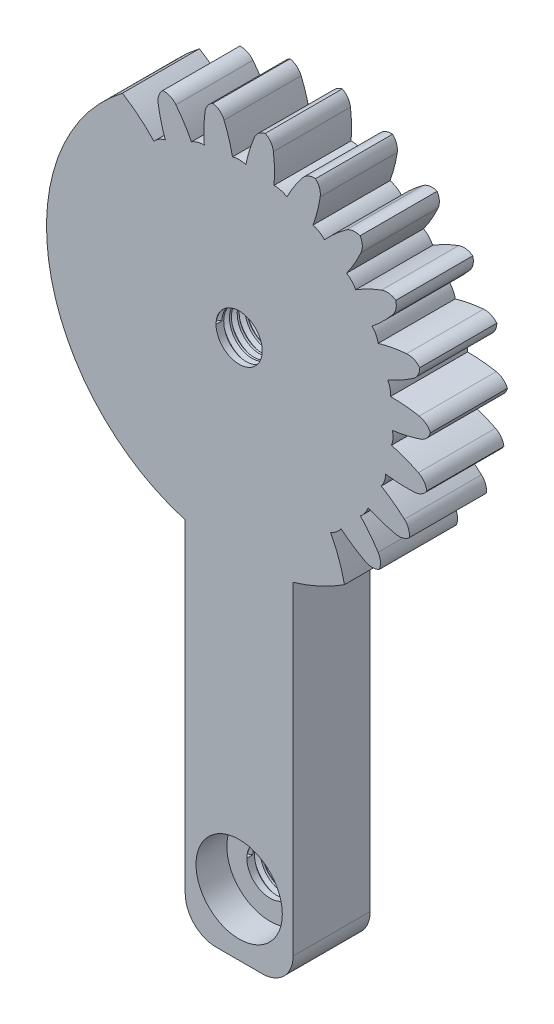
from build123d import *

# Parameters (mm, degrees)
BOSS_EXTRUDE2_DEPTH = 5
SKETCH3_R           = 1.5
CUT_EXTRUDE1_DEPTH  = 38.5
CUT_EXTRUDE2_DEPTH  = 38.5
CIRPATTERN1_COUNT   = 23
FILLET1_R           = 2
SKETCH14_R          = 2.8
CUT_EXTRUDE3_DEPTH  = 2
SKETCH15_R          = 1.5
CUT_EXTRUDE4_DEPTH  = 38.286056375
THREAD1_PITCH       = 0.5
THREAD2_PITCH       = 0.5
FILLET4_R           = 1


with BuildPart() as part:
    # Sketch1 → Boss-Extrude2 (new body)
    with BuildSketch(Plane.XY):
        with BuildLine():
            Line((3.5, -35), (3.5, -12))
            ThreePointArc((3.5, -12), (0, 12.5), (-3.5, -12))
            Line((-3.5, -12), (-3.5, -35))
            Line((-3.5, -35), (3.5, -35))
        make_face()
    extrude(amount=BOSS_EXTRUDE2_DEPTH)

    # Sketch3 → Cut-Extrude1 (cut, through all)
    with BuildSketch(Plane.XY.offset(5)):
        Circle(SKETCH3_R)
    extrude(amount=-CUT_EXTRUDE1_DEPTH, mode=Mode.SUBTRACT)

    # Sketch6 → Cut-Extrude2 (cut, through all)
    with BuildSketch(Plane.XY.offset(5)):
        with BuildLine():
            ThreePointArc((1.306605791, 12.431523692), (0, 12.5), (-1.306605791, 12.431523692))
            ThreePointArc((-1.306605791, 12.431523692), (-0.782967595, 11.214222444), (-0.433810754, 9.935899798))
            ThreePointArc((-0.433810754, 9.935899798), (0, 10), (0.433810754, 9.935899798))
            ThreePointArc((0.433810754, 9.935899798), (0.782967595, 11.214222444), (1.306605791, 12.431523692))
        make_face()
    cut_extrude2 = extrude(amount=-CUT_EXTRUDE2_DEPTH, mode=Mode.SUBTRACT)

    # CirPattern1: Cut-Extrude2 ×23 about axis, 11 skipped
    cirpattern1_axis = Axis((0, 0, 0), (0, 0, -1))
    add([cut_extrude2.rotate(cirpattern1_axis, i * 360 / CIRPATTERN1_COUNT) for i in range(1, CIRPATTERN1_COUNT) if i not in (10, 11, 12, 13, 14, 15, 16, 17, 18, 19, 20)], mode=Mode.SUBTRACT)

    # Fillet1
    fillet1_edges = [part.edges().sort_by_distance(p)[0] for p in [
        (3.5, -35, 2.5),
        (-3.5, -35, 2.5),
    ]]
    fillet(fillet1_edges, radius=FILLET1_R)

    # Sketch14 → Cut-Extrude3 (cut)
    with BuildSketch(Plane.XY.offset(5)):
        with Locations((0, -31)):
            Circle(SKETCH14_R)
    extrude(amount=-CUT_EXTRUDE3_DEPTH, mode=Mode.SUBTRACT)

    # Sketch15 → Cut-Extrude4 (cut, through all)
    with BuildSketch(Plane.XY.offset(3)):
        with Locations((0, -31)):
            Circle(SKETCH15_R)
    extrude(amount=-CUT_EXTRUDE4_DEPTH, mode=Mode.SUBTRACT)

    # Thread1: the profile of Thread Profile2 profile screwed along a right-hand helix of 20 turns, 6 arcs to a turn; built about Z, then put on its axis
    thread1_z = Axis((0, 0, 0), (0, 0, 1))
    thread1_corners = [(1.4997, 0, -0.000173205), (1.770632938, 0, 0.156249999), (1.770632938, 0, 0.218749999), (1.4997, 0, 0.375173204)]
    with BuildLine(mode=Mode.PRIVATE) as thread1_profile:
        Line(thread1_corners[0], thread1_corners[1])
        Line(thread1_corners[1], thread1_corners[2])
        Line(thread1_corners[2], thread1_corners[3])
        Line(thread1_corners[3], thread1_corners[0])
    thread1_cap = Face(thread1_profile.wire())
    thread1_turn_angles = [0, 30, 60, 90, 120, 150, 180, 210, 240, 270, 300, 330, 360]
    thread1_turn_weights = [1, 0.8660254037844387, 1, 0.8660254037844387, 1, 0.8660254037844387, 1, 0.8660254037844387, 1, 0.8660254037844387, 1, 0.8660254037844387, 1]
    thread1_turn_rails = [Edge.make_bspline([Vector(p[0], p[1], 0).rotate(thread1_z, thread1_turn_angles[k]) / thread1_turn_weights[k] + Vector(0, 0, p[2] + THREAD1_PITCH * thread1_turn_angles[k] / 360) for k in range(13)], [0, 0, 0, 1, 1, 2, 2, 3, 3, 4, 4, 5, 5, 6, 6, 6], 2, thread1_turn_weights) for p in thread1_corners]
    thread1_turn_sides = [Face.make_surface_from_curves(thread1_turn_rails[p[0]], thread1_turn_rails[p[1]]) for p in [(0, 1), (1, 2), (2, 3), (3, 0)]]
    thread1 = Plane(origin=(0, -31, 3), x_dir=(-1, 0, 0), z_dir=(0, 0, -1)) * Solid(Shell([*[p.moved(Location((0, 0, THREAD1_PITCH * i))) for i in range(20) for p in thread1_turn_sides], thread1_cap, thread1_cap.rotate(thread1_z, 7200).moved(Location((0, 0, THREAD1_PITCH * 7200 / 360)))]))
    add(thread1, mode=Mode.SUBTRACT)

    # Thread2: the profile of Thread Profile3 profile screwed along a right-hand helix of 20 turns, 6 arcs to a turn; built about Z, then put on its axis
    thread2_z = Axis((0, 0, 0), (0, 0, 1))
    thread2_corners = [(1.4997, 0, -0.000173205), (1.770632938, 0, 0.156249999), (1.770632938, 0, 0.218749999), (1.4997, 0, 0.375173204)]
    with BuildLine(mode=Mode.PRIVATE) as thread2_profile:
        Line(thread2_corners[0], thread2_corners[1])
        Line(thread2_corners[1], thread2_corners[2])
        Line(thread2_corners[2], thread2_corners[3])
        Line(thread2_corners[3], thread2_corners[0])
    thread2_cap = Face(thread2_profile.wire())
    thread2_turn_angles = [0, 30, 60, 90, 120, 150, 180, 210, 240, 270, 300, 330, 360]
    thread2_turn_weights = [1, 0.8660254037844387, 1, 0.8660254037844387, 1, 0.8660254037844387, 1, 0.8660254037844387, 1, 0.8660254037844387, 1, 0.8660254037844387, 1]
    thread2_turn_rails = [Edge.make_bspline([Vector(p[0], p[1], 0).rotate(thread2_z, thread2_turn_angles[k]) / thread2_turn_weights[k] + Vector(0, 0, p[2] + THREAD2_PITCH * thread2_turn_angles[k] / 360) for k in range(13)], [0, 0, 0, 1, 1, 2, 2, 3, 3, 4, 4, 5, 5, 6, 6, 6], 2, thread2_turn_weights) for p in thread2_corners]
    thread2_turn_sides = [Face.make_surface_from_curves(thread2_turn_rails[p[0]], thread2_turn_rails[p[1]]) for p in [(0, 1), (1, 2), (2, 3), (3, 0)]]
    thread2 = Plane(origin=(0, 0, 5), x_dir=(-1, 0, 0), z_dir=(0, 0, -1)) * Solid(Shell([*[p.moved(Location((0, 0, THREAD2_PITCH * i))) for i in range(20) for p in thread2_turn_sides], thread2_cap, thread2_cap.rotate(thread2_z, 7200).moved(Location((0, 0, THREAD2_PITCH * 7200 / 360)))]))
    add(thread2, mode=Mode.SUBTRACT)

    # Fillet4
    # the kernel refuses this fillet: 1 mm, written as the material it takes off along each edge
    with BuildSketch(Plane(origin=(-5.342830843, 11.300626469, 6.946106865), x_dir=(0.11107925591094757, -0.9938115510026386, 0), z_dir=(0, 0, -1)), Plane(origin=(-2.095831649, 12.323047095, 6.946106865), x_dir=(-0.16116701181668494, -0.9869271474136683, 0), z_dir=(0, 0, -1)), Plane(origin=(1.306605791, 12.431523692, 6.946106865), x_dir=(-0.42146025956788974, -0.9068468721923051, 0), z_dir=(0, 0, -1)), Plane(origin=(4.612138256, 11.618011048, 6.946106865), x_dir=(-0.6504957279193413, -0.759509913008834, 0), z_dir=(0, 0, -1)), Plane(origin=(7.575609527, 9.942843673, 6.946106865), x_dir=(-0.8312869039509612, -0.5558435781041511, 0), z_dir=(0, 0, -1))) as fillet4_piece_1:
        with BuildLine():
            CenterArc((0.737472075, -0.99916035), FILLET4_R, 87.651896245, 76.940630342)
            ThreePointArc((-0.226588683, -0.733478482), (-0.11892644, -0.364999354), (0, 0))
            ThreePointArc((0, 0), (0.389221373, 0.007976679), (0.778442746, 0))
        make_face()
    extrude(amount=8.892213729, mode=Mode.SUBTRACT)
    with BuildSketch(Plane(origin=(-1.306605791, 12.431523692, 6.946106865), x_dir=(-0.9908431231587757, -0.13501816651459636, 0), z_dir=(0, 0, -1)), Plane(origin=(-4.612138256, 11.618011048, 6.946106865), x_dir=(-0.9176725069660869, -0.3973376019942952, 0), z_dir=(0, 0, -1)), Plane(origin=(2.095831649, 12.323047095, 6.946106865), x_dir=(-0.9905274377124492, 0.13731494870847072, 0), z_dir=(0, 0, -1)), Plane(origin=(5.342830843, 11.300626469, 6.946106865), x_dir=(-0.916748863572502, 0.3994640423599176, 0), z_dir=(0, 0, -1)), Plane(origin=(8.193576715, 9.440090074, 6.946106865), x_dir=(-0.7749792200683714, 0.6319867154159323, 0), z_dir=(0, 0, -1))) as fillet4_piece_2:
        with BuildLine():
            CenterArc((0.736973133, -0.999528422), FILLET4_R, 88.240329629, 76.940630342)
            ThreePointArc((-0.229765315, -0.743761392), (-0.122503958, -0.369526298), (0, 0))
            ThreePointArc((0, 0), (0.383840173, 0.005894721), (0.767680347, 0))
        make_face()
    extrude(amount=8.892213729, mode=Mode.SUBTRACT)
    with BuildSketch(Plane(origin=(9.977232494, 7.530261068, 6.946106865), x_dir=(0.5776269562288467, -0.8163008633082524, 0), z_dir=(0, 0, -1)), Plane(origin=(11.638889771, 4.559193448, 6.946106865), x_dir=(0.3359716445775918, -0.9418721006802507, 0), z_dir=(0, 0, -1)), Plane(origin=(12.437343837, 1.249991308, 6.946106865), x_dir=(0.06939885301601875, -0.9975889931229499, 0), z_dir=(0, 0, -1)), Plane(origin=(12.313377009, -2.15191697, 6.946106865), x_dir=(-0.20232093399512463, -0.9793192736116964, 0), z_dir=(0, 0, -1)), Plane(origin=(11.276183337, -5.39422741, 6.946106865), x_dir=(-0.45903550288854034, -0.8884179236642319, 0), z_dir=(0, 0, -1)), Plane(origin=(9.402686732, -8.23647268, 6.946106865), x_dir=(-0.6817055084803998, -0.7316266805601608, 0), z_dir=(0, 0, -1))) as fillet4_piece_3:
        with BuildLine():
            CenterArc((0.736973133, 0.999528422), FILLET4_R, 194.819040029, 76.940630342)
            ThreePointArc((-0.229765315, 0.743761392), (-0.122503958, 0.369526298), (0, 0))
            ThreePointArc((0, 0), (0.383840173, -0.005894721), (0.767680347, 0))
        make_face()
    extrude(amount=8.892213729, mode=Mode.SUBTRACT)
    with BuildSketch(Plane(origin=(10.436642486, 6.879425384, 6.946106865), x_dir=(-0.6112768029536927, -0.7914168750858882, 0), z_dir=(0, 0, -1)), Plane(origin=(11.905670228, 3.808545185, 6.946106865), x_dir=(-0.8021307184561606, -0.5971484827988793, 0), z_dir=(0, 0, -1)), Plane(origin=(12.491708874, 0.455202613, 6.946106865), x_dir=(-0.9334942680746003, -0.3585923193152164, 0), z_dir=(0, 0, -1)), Plane(origin=(12.151294618, -2.931900255, 6.946106865), x_dir=(-0.9956248182820677, -0.09344100395864456, 0), z_dir=(0, 0, -1)), Plane(origin=(10.909674429, -6.101557494, 6.946106865), x_dir=(-0.9839144303980275, 0.17864040319738686, 0), z_dir=(0, 0, -1)), Plane(origin=(8.858933596, -8.818690126, 6.946106865), x_dir=(-0.8992316103203805, 0.43747286887373443, 0), z_dir=(0, 0, -1))) as fillet4_piece_4:
        with BuildLine():
            CenterArc((0.737472075, 0.99916035), FILLET4_R, 195.407473413, 76.940630342)
            ThreePointArc((-0.226588683, 0.733478482), (-0.11892644, 0.364999354), (0, 0))
            ThreePointArc((0, 0), (0.389221373, -0.007976679), (0.778442746, 0))
        make_face()
    extrude(amount=8.892213729, mode=Mode.SUBTRACT)


solid = part.part
